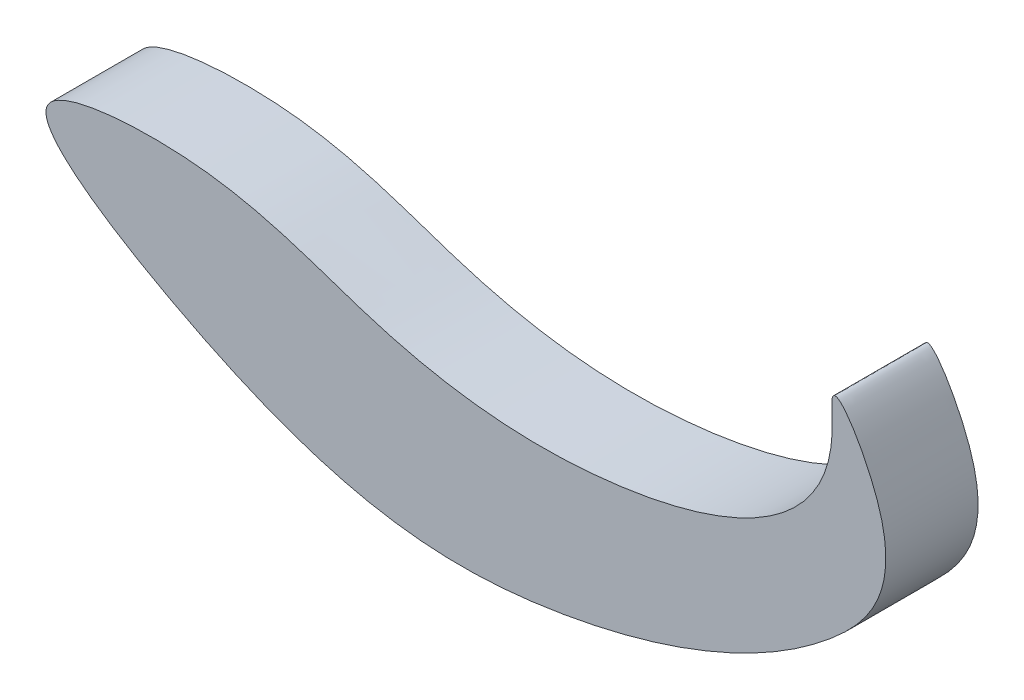
from build123d import *

# Parameters (mm, degrees)
BOSS_EXTRUDE2_DEPTH = 10
SCALE1_DEPTH        = 10
SCALE1_2_DEPTH      = 2.917258092
SCALE1_START        = 7.083258092
SCALE1_3_DEPTH      = 2.916741908
SCALE1_START_2      = 2.917258092
SCALE1_4_DEPTH      = 4.166


# Read off the part's stored shape, not the designer's step: Scale1
with BuildPart() as part:
    # Sketch3 → Boss-Extrude2 (new body)
    with BuildSketch(Plane.XY):
        with BuildLine():
            add(Edge.make_bspline(
                [(20, 2.5), (21.250681983, 4.775702663), (39.183829626, 6.311717414), (55.757552276, -1.26958264), (80.340717952, -4.939069664), (106.245444145, 3.433289975), (104.51524662, 20.709862477), (114.294165583, 5.144984819), (102.203953975, -10.289917339), (70.984056719, -20.555591173), (45.791759143, -17.690401013), (18.394127914, -0.421995705), (20, 2.5)],
                knots=[0, 0, 0, 0, 0.071896372, 0.16936404, 0.288150463, 0.432428176, 0.444247867, 0.486864368, 0.561618657, 0.715274637, 0.907685264, 1, 1, 1, 1], degree=3))
        make_face()
    extrude(amount=BOSS_EXTRUDE2_DEPTH)

    # Scale1 outline → Scale1 (cut)
    with BuildSketch(Plane.XY):
        with BuildLine():
            add(Edge.make_bspline(
                [(84.704954307, -1.843411313), (84.415782831, -3.280090947), (80.378807179, -7.737813536), (68.205163412, -11.740730498), (57.710052243, -10.547092277), (43.414072132, -1.536503852), (54.957188806, -0.54780974), (61.861801661, -3.706179343), (69.794375776, -4.89026109), (76.321717635, -3.534431932), (78.199927105, -2.659394701)],
                knots=[0, 0, 0, 0, 0.047816314, 0.201472295, 0.393882921, 0.486197658, 0.55809403, 0.655561697, 0.77434812, 0.837348829, 0.837348829, 0.837348829, 0.837348829], degree=3))
            add(Edge.make_bspline(
                [(78.199927105, -2.659394701), (69.472792329, -3.31212959), (55.321838244, -1.070274441), (39.183829626, 6.311717414), (11.475916344, 3.938471826), (45.791759143, -17.690401013), (70.984056719, -20.555591173), (102.203953975, -10.289917339), (114.294165583, 5.144984819), (104.51524662, 20.709862477), (106.077294031, 5.112322334), (94.928946048, -0.009730644), (84.704954307, -1.843411313)],
                knots=[0.719424854, 0.719424854, 0.719424854, 0.719424854, 0.83063596, 0.928103628, 1, 1.092314736, 1.284725363, 1.438381343, 1.513135632, 1.555752133, 1.567571824, 1.692537427, 1.692537427, 1.692537427, 1.692537427], degree=3))
        make_face()
    extrude(amount=SCALE1_DEPTH, mode=Mode.SUBTRACT)

    # Scale1 2 outline → Scale1 2 (cut)
    with BuildSketch(Plane.XY):
        with BuildLine():
            add(Edge.make_bspline(
                [(78.199927105, -2.659394701), (76.321717635, -3.534431932), (69.794375776, -4.89026109), (61.861801661, -3.706179343), (54.957188806, -0.54780974), (43.414072132, -1.536503852), (57.710052243, -10.547092277), (68.205163412, -11.740730498), (80.378807179, -7.737813536), (84.415782831, -3.280090947), (84.704954307, -1.843411313)],
                knots=[0.648848828, 0.648848828, 0.648848828, 0.648848828, 0.711849537, 0.83063596, 0.928103628, 1, 1.092314736, 1.284725363, 1.438381343, 1.486197658, 1.486197658, 1.486197658, 1.486197658], degree=3))
            add(Edge.make_bspline(
                [(84.704954307, -1.843411313), (83.124944657, -2.126787242), (80.923868596, -2.426696117), (78.794389414, -2.614932653), (78.199927105, -2.659394701)],
                knots=[0.692537427, 0.692537427, 0.692537427, 0.692537427, 0.711849537, 0.719424854, 0.719424854, 0.719424854, 0.719424854], degree=3))
        make_face()
    extrude(amount=SCALE1_2_DEPTH, mode=Mode.SUBTRACT)

    # Scale1 3 outline → Scale1 3 (cut)
    with BuildSketch(Plane.XY.offset(SCALE1_START)):
        with BuildLine():
            add(Edge.make_bspline(
                [(78.199927105, -2.659394701), (76.321717635, -3.534431932), (69.794375776, -4.89026109), (61.861801661, -3.706179343), (54.957188806, -0.54780974), (43.414072132, -1.536503852), (57.710052243, -10.547092277), (68.205163412, -11.740730498), (80.378807179, -7.737813536), (84.415782831, -3.280090947), (84.704954307, -1.843411313)],
                knots=[0.648848828, 0.648848828, 0.648848828, 0.648848828, 0.711849537, 0.83063596, 0.928103628, 1, 1.092314736, 1.284725363, 1.438381343, 1.486197658, 1.486197658, 1.486197658, 1.486197658], degree=3))
            add(Edge.make_bspline(
                [(84.704954307, -1.843411313), (83.124944657, -2.126787242), (80.923868596, -2.426696117), (78.794389414, -2.614932653), (78.199927105, -2.659394701)],
                knots=[0.692537427, 0.692537427, 0.692537427, 0.692537427, 0.711849537, 0.719424854, 0.719424854, 0.719424854, 0.719424854], degree=3))
        make_face()
    extrude(amount=SCALE1_3_DEPTH, mode=Mode.SUBTRACT)

    # Scale1 4 outline → Scale1 4 (add)
    with BuildSketch(Plane.XY.offset(SCALE1_START_2)):
        with BuildLine():
            add(Edge.make_bspline(
                [(84.704954307, -1.843411313), (83.124944657, -2.126787242), (80.923868596, -2.426696117), (78.794389414, -2.614932653), (78.199927105, -2.659394701)],
                knots=[0.692537427, 0.692537427, 0.692537427, 0.692537427, 0.711849537, 0.719424854, 0.719424854, 0.719424854, 0.719424854], degree=3))
            add(Edge.make_bspline(
                [(84.704954307, -1.843411313), (84.867863011, -1.034038198), (84.740313256, 1.366125688), (82.174257125, 5.450457493), (82.666533249, 0.534923855), (80.622998854, -1.5305121), (78.199927105, -2.659394701)],
                knots=[0.486197658, 0.486197658, 0.486197658, 0.486197658, 0.513135632, 0.555752133, 0.567571824, 0.648848828, 0.648848828, 0.648848828, 0.648848828], degree=3))
        make_face()
    extrude(amount=SCALE1_4_DEPTH)


solid = part.part
